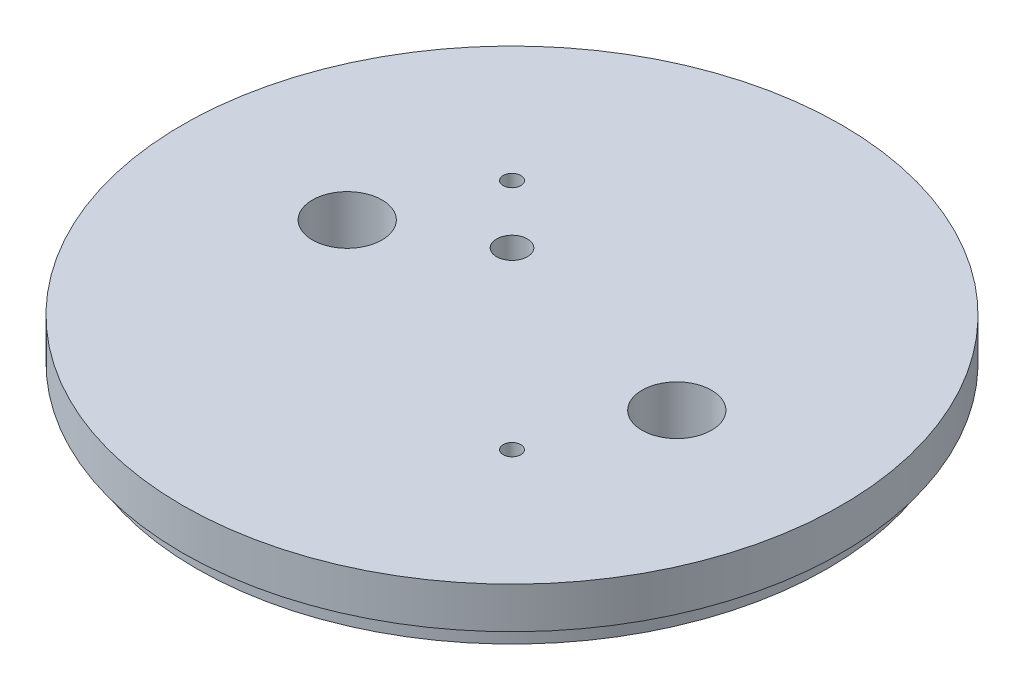
from build123d import *

# Parameters (mm, degrees)
SKETCH1_R           = 50.8
SKETCH1_R_2         = 5.3578125
SKETCH1_R_3         = 1.3589
SKETCH1_R_4         = 2.38125
BOSS_EXTRUDE1_DEPTH = 9.525
SKETCH2_R           = 50.8
SKETCH2_R_2         = 48.641
CUT_EXTRUDE1_DEPTH  = 3.175
CUT_EXTRUDE2_START  = -5.969
CUT_EXTRUDE2_DEPTH  = 3.556


with BuildPart() as part:
    # Sketch1 → Boss-Extrude1 (new body)
    with BuildSketch(Plane(origin=(0, 0, 0), x_dir=(1, 0, 0), z_dir=(0, 1, 0))):
        Circle(SKETCH1_R)
        with Locations((25.4, 0)):
            Circle(SKETCH1_R_2, mode=Mode.SUBTRACT)
        with Locations((-25.4, 0)):
            Circle(SKETCH1_R_2, mode=Mode.SUBTRACT)
        with Locations((-17.960512242, 17.960512242)):
            Circle(SKETCH1_R_3, mode=Mode.SUBTRACT)
        with Locations((17.960512242, -17.960512242)):
            Circle(SKETCH1_R_3, mode=Mode.SUBTRACT)
        with Locations((-8.980256121, 8.980256121)):
            Circle(SKETCH1_R_4, mode=Mode.SUBTRACT)
    extrude(amount=BOSS_EXTRUDE1_DEPTH)

    # Sketch2 → Cut-Extrude1 (cut)
    with BuildSketch(Plane.XZ):
        Circle(SKETCH2_R)
        Circle(SKETCH2_R_2, mode=Mode.SUBTRACT)
    extrude(amount=-CUT_EXTRUDE1_DEPTH, mode=Mode.SUBTRACT)

    # Sketch3 → Cut-Extrude2 (cut)
    with BuildSketch(Plane(origin=(0, 9.525, 0), x_dir=(1, 0, 0), z_dir=(0, 1, 0)).offset(CUT_EXTRUDE2_START)):
        with BuildLine():
            Line((3.2385, 34.798), (3.2385, 13.97))
            ThreePointArc((3.2385, 13.97), (0, 10.7315), (-3.2385, 13.97))
            Line((-3.2385, 13.97), (-3.2385, 34.798))
            ThreePointArc((-3.2385, 34.798), (0, 38.0365), (3.2385, 34.798))
        make_face()
        with BuildLine():
            Line((3.2385, -34.798), (3.2385, -13.97))
            ThreePointArc((3.2385, -13.97), (0, -10.7315), (-3.2385, -13.97))
            Line((-3.2385, -13.97), (-3.2385, -34.798))
            ThreePointArc((-3.2385, -34.798), (0, -38.0365), (3.2385, -34.798))
        make_face()
    extrude(amount=-CUT_EXTRUDE2_DEPTH, mode=Mode.SUBTRACT)


solid = part.part
